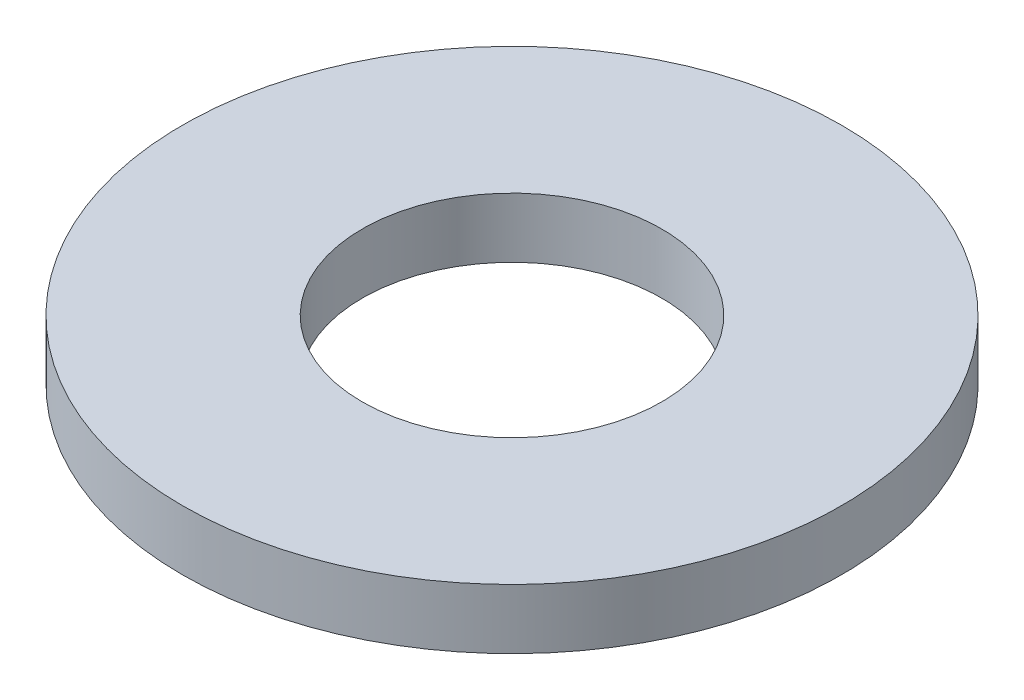
from build123d import *

# Parameters (mm, degrees)
SKETCH1_R           = 11
SKETCH1_R_2         = 5
BOSS_EXTRUDE1_DEPTH = 2


with BuildPart() as part:
    # Sketch1 → Boss-Extrude1 (new body)
    with BuildSketch(Plane(origin=(0, 0, 0), x_dir=(1, 0, 0), z_dir=(0, 1, 0))):
        Circle(SKETCH1_R)
        Circle(SKETCH1_R_2, mode=Mode.SUBTRACT)
    extrude(amount=BOSS_EXTRUDE1_DEPTH)


solid = part.part
